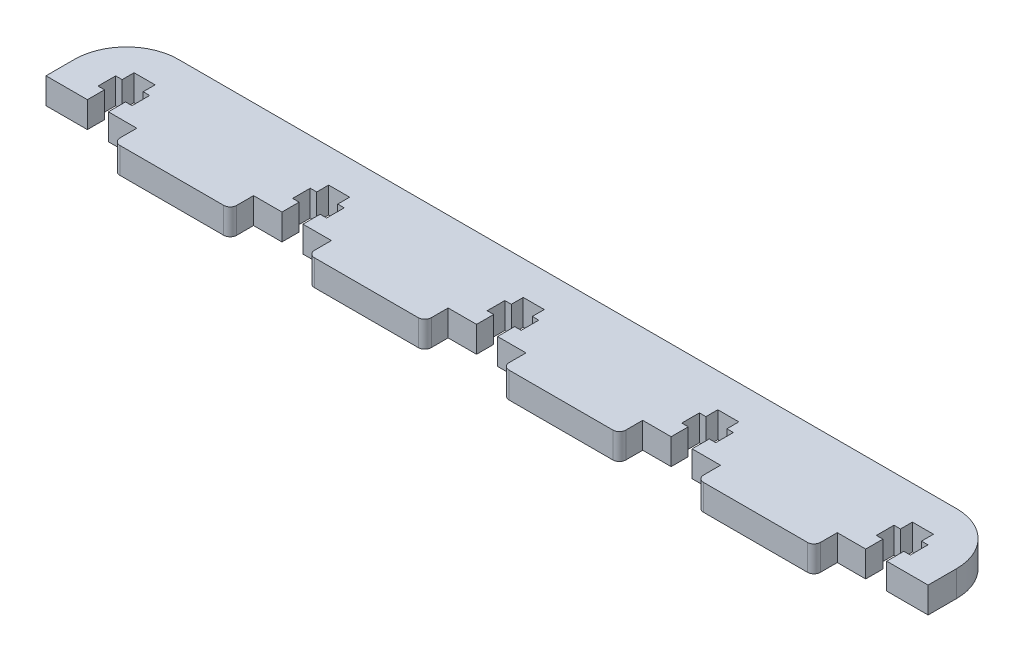
from build123d import *

# Parameters (mm, degrees)
SKETCH1_W                  = 340
SKETCH1_H                  = 40
BOSS_EXTRUDE1_DEPTH        = 10
CUT_EXTRUDE1_DEPTH         = 172.464281995
FILLET1_R                  = 2.5
LPATTERN1_COUNT            = 3
LPATTERN1_PITCH            = 75
FILLET1_OF_LPATTERN1_R     = 2.5
LPATTERN1_COL_COUNT        = 3
LPATTERN1_COL_PITCH        = 75
FILLET1_OF_LPATTERN1_COL_R = 2.5
SKETCH3_W                  = 5
SKETCH3_H                  = 9
CUT_EXTRUDE2_DEPTH         = 172.464281995
FILLET2_R                  = 20


with BuildPart() as part:
    # Sketch1 → Boss-Extrude1 (new body)
    with BuildSketch(Plane(origin=(0, 0, 0), x_dir=(1, 0, 0), z_dir=(0, 1, 0))):
        Rectangle(SKETCH1_W, SKETCH1_H)
    extrude(amount=BOSS_EXTRUDE1_DEPTH)

    # Sketch2 → Cut-Extrude1 (cut, through all)
    with BuildSketch(Plane(origin=(0, 10, 0), x_dir=(1, 0, 0), z_dir=(0, 1, 0))):
        Polygon((4.05, 7), (-4.05, 7), (-4.05, 2.4), (-6.55, 2.4), (-6.55, -4.4), (-4.05, -4.4), (-4.05, -11), (-15, -11), (-15, -20), (15, -20), (15, -11), (4.05, -11), (4.05, -4.4), (6.55, -4.4), (6.55, 2.4), (4.05, 2.4), align=None)
    cut_extrude1 = extrude(amount=-CUT_EXTRUDE1_DEPTH, mode=Mode.SUBTRACT)

    # Fillet1
    fillet1_edges = [part.edges().sort_by_distance(p)[0] for p in [
        (15, 5, 20),
        (-15, 5, 20),
    ]]
    fillet(fillet1_edges, radius=FILLET1_R)

    # LPattern1: Cut-Extrude1 ×3
    with Locations(*[(i * LPATTERN1_PITCH, 0, 0) for i in range(1, LPATTERN1_COUNT)]):
        add(cut_extrude1, mode=Mode.SUBTRACT)

    # Fillet1 of LPattern1
    fillet1_of_lpattern1_edges = [part.edges().sort_by_distance(p)[0] for p in [
        (90, 5, 20),
        (60, 5, 20),
        (165, 5, 20),
        (135, 5, 20),
    ]]
    fillet(fillet1_of_lpattern1_edges, radius=FILLET1_OF_LPATTERN1_R)

    # LPattern1 col: Cut-Extrude1 ×3
    with Locations(*[(-i * LPATTERN1_COL_PITCH, 0, 0) for i in range(1, LPATTERN1_COL_COUNT)]):
        add(cut_extrude1, mode=Mode.SUBTRACT)

    # Fillet1 of LPattern1 col
    fillet1_of_lpattern1_col_edges = [part.edges().sort_by_distance(p)[0] for p in [
        (-60, 5, 20),
        (-90, 5, 20),
        (-135, 5, 20),
        (-165, 5, 20),
    ]]
    fillet(fillet1_of_lpattern1_col_edges, radius=FILLET1_OF_LPATTERN1_COL_R)

    # Sketch3 → Cut-Extrude2 (cut, through all)
    with BuildSketch(Plane(origin=(0, 10, 0), x_dir=(1, 0, 0), z_dir=(0, 1, 0))):
        with Locations((-167.5, -15.5)):
            Rectangle(SKETCH3_W, SKETCH3_H)
    cut_extrude2 = extrude(amount=-CUT_EXTRUDE2_DEPTH, mode=Mode.SUBTRACT)

    # Mirror1: Cut-Extrude2 across plane
    add(cut_extrude2.mirror(Plane(origin=(0, 0, 0), x_dir=(0, 0, 1), z_dir=(1, 0, 0))), mode=Mode.SUBTRACT)

    # Fillet2
    fillet2_edges = [part.edges().sort_by_distance(p)[0] for p in [
        (170, 5, -20),
        (-170, 5, -20),
    ]]
    fillet(fillet2_edges, radius=FILLET2_R)


solid = part.part
